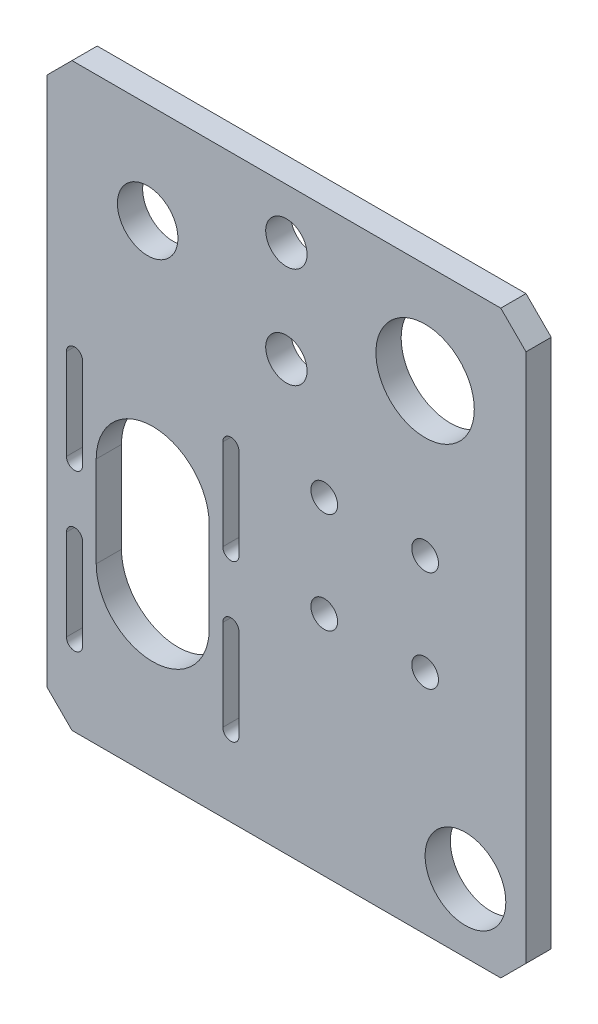
from build123d import *

# Parameters (mm, degrees)
SKETCH_1_W          = 95
SKETCH_1_H          = 75
EXTRUDE_1_DEPTH     = 5
HOLE_WIZARD_M5_1_D  = 5.3
CUT_EXTRUDE_2_DEPTH = 61.724789007
CUT_EXTRUDE_3_REACH = 62.725
SKETCH_4_R          = 8
SKETCH_7_W          = 95
SKETCH_7_H          = 5
EXTRUDE_2_DEPTH     = 40
CUT_EXTRUDE_4_REACH = 93.036
SKETCH_8_R          = 9.75
CUT_EXTRUDE_5_REACH = 93.036
SKETCH_9_R          = 4.1
CUT_EXTRUDE_6_REACH = 93.036
SKETCH_10_R         = 6
CHAMFER_2_SIZE      = 5


with BuildPart() as part:
    # 草圖1 → 填料-伸長1 (new body)
    with BuildSketch(Plane.XY):
        Rectangle(SKETCH_1_W, SKETCH_1_H)
    extrude(amount=EXTRUDE_1_DEPTH)

    # M5 餘隙孔1 (through all)
    with Locations(Plane.XY.offset(5)):
        with Locations((27.5, 27.5), (7.5, 7.5), (7.5, 27.5), (27.5, 7.5)):
            Hole(HOLE_WIZARD_M5_1_D / 2)

    # 草圖6 → 除料-伸長2 (cut, through all)
    with BuildSketch(Plane.XY.offset(5)):
        with BuildLine():
            Line((-37.7, -6.5), (-37.7, 11.5))
            ThreePointArc((-37.7, 11.5), (-26.5, 22.7), (-15.3, 11.5))
            Line((-15.3, 11.5), (-15.3, -6.5))
            ThreePointArc((-15.3, -6.5), (-26.5, -17.7), (-37.7, -6.5))
        make_face()
        with BuildLine():
            Line((-40.4, 27), (-40.4, 9))
            ThreePointArc((-40.4, 9), (-42, 7.4), (-43.6, 9))
            Line((-43.6, 9), (-43.6, 27))
            ThreePointArc((-43.6, 27), (-42, 28.6), (-40.4, 27))
        make_face()
        with BuildLine():
            Line((-9.4, 27), (-9.4, 9))
            ThreePointArc((-9.4, 9), (-11, 7.4), (-12.6, 9))
            Line((-12.6, 9), (-12.6, 27))
            ThreePointArc((-12.6, 27), (-11, 28.6), (-9.4, 27))
        make_face()
        with BuildLine():
            Line((-9.4, -4), (-9.4, -22))
            ThreePointArc((-9.4, -22), (-11, -23.6), (-12.6, -22))
            Line((-12.6, -22), (-12.6, -4))
            ThreePointArc((-12.6, -4), (-11, -2.4), (-9.4, -4))
        make_face()
        with BuildLine():
            Line((-40.4, -4), (-40.4, -22))
            ThreePointArc((-40.4, -22), (-42, -23.6), (-43.6, -22))
            Line((-43.6, -22), (-43.6, -4))
            ThreePointArc((-43.6, -4), (-42, -2.4), (-40.4, -4))
        make_face()
    extrude(amount=-CUT_EXTRUDE_2_DEPTH, mode=Mode.SUBTRACT)

    # 草圖4 → 除料-伸長3 (cut, up to next)
    with BuildSketch(Plane.XY.offset(5), mode=Mode.PRIVATE) as cut_extrude_3_sk1:
        with Locations((35.5, -24)):
            Circle(SKETCH_4_R)
    cut_extrude_3_tool1 = extrude(cut_extrude_3_sk1.sketch, amount=-CUT_EXTRUDE_3_REACH, mode=Mode.PRIVATE) & part.part
    add(cut_extrude_3_tool1.solids().sort_by_distance((35.5, -24, 5))[0], mode=Mode.SUBTRACT)

    # 草圖7 → 填料-伸長2 (add)
    with BuildSketch(Plane(origin=(0, 37.5, 0), x_dir=(1, 0, 0), z_dir=(0, 1, 0))):
        with Locations((0, -2.5)):
            Rectangle(SKETCH_7_W, SKETCH_7_H)
    extrude(amount=EXTRUDE_2_DEPTH)

    # 草圖8 → 除料-伸長4 (cut, up to next)
    with BuildSketch(Plane.XY.offset(5), mode=Mode.PRIVATE) as cut_extrude_4_sk1:
        with Locations((27.5, 57.5)):
            Circle(SKETCH_8_R)
    cut_extrude_4_tool1 = extrude(cut_extrude_4_sk1.sketch, amount=-CUT_EXTRUDE_4_REACH, mode=Mode.PRIVATE) & part.part
    add(cut_extrude_4_tool1.solids().sort_by_distance((27.5, 57.5, 5))[0], mode=Mode.SUBTRACT)

    # 草圖9 → 除料-伸長5 (cut, up to next)
    with BuildSketch(Plane.XY.offset(5), mode=Mode.PRIVATE) as cut_extrude_5_sk1:
        with Locations((0, 67.5)):
            Circle(SKETCH_9_R)
    cut_extrude_5_tool1 = extrude(cut_extrude_5_sk1.sketch, amount=-CUT_EXTRUDE_5_REACH, mode=Mode.PRIVATE) & part.part
    # 草圖9 → 除料-伸長5 (cut, up to next)
    with BuildSketch(Plane.XY.offset(5), mode=Mode.PRIVATE) as cut_extrude_5_sk2:
        with Locations((0, 47.5)):
            Circle(SKETCH_9_R)
    cut_extrude_5_tool2 = extrude(cut_extrude_5_sk2.sketch, amount=-CUT_EXTRUDE_5_REACH, mode=Mode.PRIVATE) & part.part
    add(cut_extrude_5_tool1.solids().sort_by_distance((0, 67.5, 5))[0], mode=Mode.SUBTRACT)
    add(cut_extrude_5_tool2.solids().sort_by_distance((0, 47.5, 5))[0], mode=Mode.SUBTRACT)

    # 草圖10 → 除料-伸長6 (cut, up to next)
    with BuildSketch(Plane.XY.offset(5), mode=Mode.PRIVATE) as cut_extrude_6_sk1:
        with Locations((-27.5, 57.5)):
            Circle(SKETCH_10_R)
    cut_extrude_6_tool1 = extrude(cut_extrude_6_sk1.sketch, amount=-CUT_EXTRUDE_6_REACH, mode=Mode.PRIVATE) & part.part
    add(cut_extrude_6_tool1.solids().sort_by_distance((-27.5, 57.5, 5))[0], mode=Mode.SUBTRACT)

    # 導角2
    chamfer_2_edges = [part.edges().sort_by_distance(p)[0] for p in [
        (-47.5, -37.5, 2.5),
        (47.5, -37.5, 2.5),
        (-47.5, 77.5, 2.5),
        (47.5, 77.5, 2.5),
    ]]
    chamfer(chamfer_2_edges, length=CHAMFER_2_SIZE)


solid = part.part
